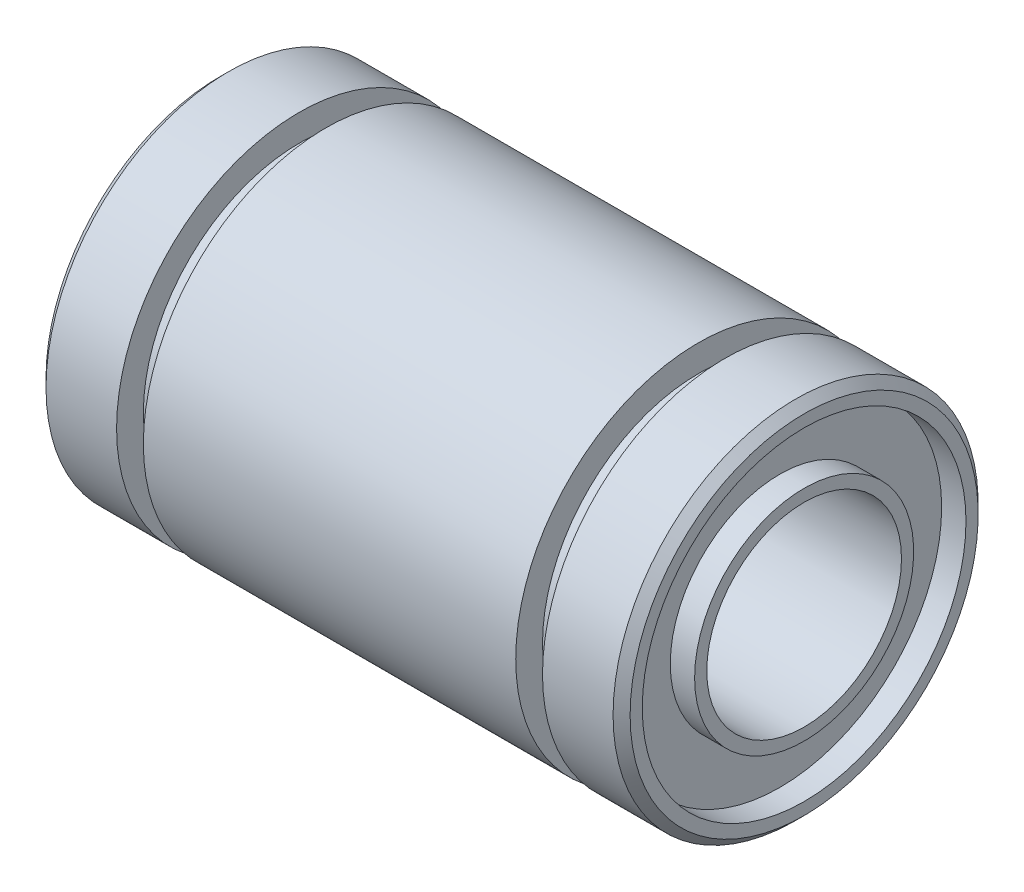
from build123d import *


with BuildPart() as part:
    # Sketch1 → Revolve1 (revolve)
    with BuildSketch(Plane.XY):
        Polygon((-8.75, 7.5), (-11.65, 7.5), (-12, 7.15), (-12, 6.65), (-11, 6.65), (-11, 4.5), (-12, 4.5), (-12, 4), (12, 4), (12, 4.5), (11, 4.5), (11, 6.65), (12, 6.65), (12, 7.15), (11.65, 7.5), (8.75, 7.5), (8.75, 6.4), (7.65, 6.4), (7.65, 7.5), (-7.65, 7.5), (-7.65, 6.4), (-8.75, 6.4), align=None)
    revolve(axis=Axis((-45.689505325, 0, 0), (1, 0, 0)))


solid = part.part
